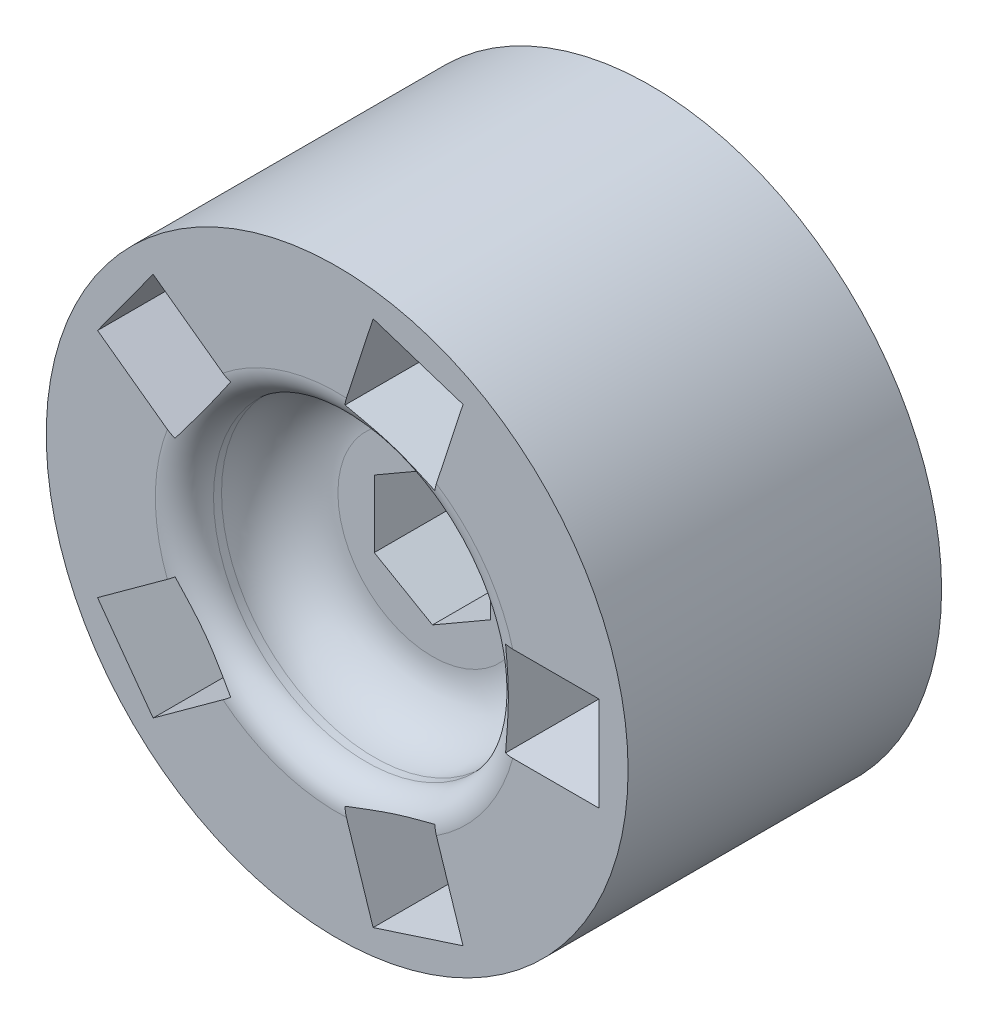
from build123d import *

# Parameters (mm, degrees)
SKETCH1_R                       = 20
SKETCH1_R_2                     = 1
BOSS_EXTRUDE1_DEPTH             = 21.55
TAP_DRILL_FOR_M5X0_8_TAP1_D     = 4.2
TAP_DRILL_FOR_M5X0_8_TAP1_DEPTH = 5
TAP_DRILL_FOR_M5X0_8_TAP1_TIP   = 1.2618073
SKETCH4_W                       = 6.5
SKETCH4_H                       = 6.5
CUT_EXTRUDE1_DEPTH              = 19.05
CIRPATTERN1_COUNT               = 5
SKETCH5_R                       = 6
SKETCH5_R_2                     = 5
CUT_EXTRUDE2_DEPTH              = 1
FILLET3_R                       = 0.5
CUT_EXTRUDE3_START              = -21.55
SKETCH6_W                       = 8
SKETCH6_H                       = 4.618
SKETCH6_R                       = 2.1
CUT_EXTRUDE3_DEPTH              = 21.55
SKETCH7_R                       = 10.5
CUT_EXTRUDE4_DEPTH              = 6.55
FILLET4_R                       = 2
FILLET5_R                       = 4


# Some blends are built 0.0001 mm under size
with BuildPart() as part:
    # Sketch1 → Boss-Extrude1 (new body)
    with BuildSketch(Plane.XY):
        with Locations((-11.822558412, 14.529752947)):
            Circle(SKETCH1_R)
        with Locations((-11.822558412, 14.529752947)):
            Circle(SKETCH1_R_2, mode=Mode.SUBTRACT)
    extrude(amount=BOSS_EXTRUDE1_DEPTH)

    # Tap Drill for M5x0.8 Tap1
    with Locations(Plane.XY.offset(21.55)):
        with Locations((-11.822558412, 14.529752947)):
            Hole(TAP_DRILL_FOR_M5X0_8_TAP1_D / 2, depth=TAP_DRILL_FOR_M5X0_8_TAP1_DEPTH)
            with Locations((0, 0, -(TAP_DRILL_FOR_M5X0_8_TAP1_DEPTH + TAP_DRILL_FOR_M5X0_8_TAP1_TIP / 2))):  # 118° drill point
                Cone(0, TAP_DRILL_FOR_M5X0_8_TAP1_D / 2, TAP_DRILL_FOR_M5X0_8_TAP1_TIP, mode=Mode.SUBTRACT)

    # Sketch4 → Cut-Extrude1 (cut)
    with BuildSketch(Plane.XY.offset(21.55)):
        with Locations((2.927441588, 14.529752947)):
            Rectangle(SKETCH4_W, SKETCH4_H)
    cut_extrude1 = extrude(amount=-CUT_EXTRUDE1_DEPTH, mode=Mode.SUBTRACT)

    # CirPattern1: Cut-Extrude1 ×5 about axis
    cirpattern1_axis = Axis((-11.822558412, 14.529752947, 0), (0, 0, 1))
    for i in range(1, CIRPATTERN1_COUNT):
        add(cut_extrude1.rotate(cirpattern1_axis, i * 360 / CIRPATTERN1_COUNT), mode=Mode.SUBTRACT)

    # Sketch5 → Cut-Extrude2 (cut)
    with BuildSketch(Plane(origin=(0, 0, 0), x_dir=(-1, 0, 0), z_dir=(0, 0, -1))):
        with Locations((11.822558412, 14.529752947)):
            Circle(SKETCH5_R)
        with Locations((11.822558412, 14.529752947)):
            Circle(SKETCH5_R_2, mode=Mode.SUBTRACT)
    extrude(amount=-CUT_EXTRUDE2_DEPTH, mode=Mode.SUBTRACT)

    # Fillet3
    fillet3_edges = [part.edges().sort_by_distance(p)[0] for p in [
        (-5.822558412, 14.529752947, 1),
        (-6.822558412, 14.529752947, 1),
    ]]
    fillet(fillet3_edges, radius=FILLET3_R - 0.0001)  # a hair under: the kernel refuses the full size

    # Sketch6 → Cut-Extrude3 (cut)
    # profile 1 of 4: a face of its own
    with BuildSketch(Plane.XY.offset(21.55).offset(CUT_EXTRUDE3_START)):
        with Locations((-11.822558412, 14.529752947)):
            Rectangle(SKETCH6_W, SKETCH6_H)
        with Locations((-11.822558412, 14.529752947)):
            Circle(SKETCH6_R, mode=Mode.SUBTRACT)
    # profile 2 of 4: a face of its own
    with BuildSketch(Plane.XY.offset(21.55).offset(CUT_EXTRUDE3_START)):
        with Locations((-11.822558412, 14.529752947)):
            Circle(SKETCH6_R)
    # profile 3 of 4: a face of its own
    with BuildSketch(Plane.XY.offset(21.55).offset(CUT_EXTRUDE3_START)):
        Polygon((-11.822558412, 19.146549298), (-7.822558412, 16.838752947), (-15.822558412, 16.838752947), align=None)
    # profile 4 of 4: a face of its own
    with BuildSketch(Plane.XY.offset(21.55).offset(CUT_EXTRUDE3_START)):
        Polygon((-11.822558412, 9.912956595), (-15.822558412, 12.220752947), (-7.822558412, 12.220752947), align=None)
    extrude(amount=CUT_EXTRUDE3_DEPTH, mode=Mode.SUBTRACT)

    # Sketch7 → Cut-Extrude4 (cut)
    with BuildSketch(Plane.XY.offset(21.55)):
        with Locations((-11.822558412, 14.529752947)):
            Circle(SKETCH7_R)
    extrude(amount=-CUT_EXTRUDE4_DEPTH, mode=Mode.SUBTRACT)

    # Fillet4
    # the kernel refuses this fillet: 2 mm, written as the material it takes off along each edge
    with BuildSketch(Plane(origin=(-11.822558412, 14.529752947, 21.55), x_dir=(1, 0, 0), z_dir=(0, -1, 0))) as fillet4_piece_1:
        with BuildLine():
            CenterArc((10.5 + FILLET4_R, -FILLET4_R), FILLET4_R, 90, 90)
            Line((10.5, -FILLET4_R), (10.5, 0))
            Line((10.5, 0), (10.5 + FILLET4_R, 0))
        make_face()
    revolve(axis=Axis((-11.822558412, 14.529752947, 21.55), (0, 0, 1)), mode=Mode.SUBTRACT)

    # Fillet5
    fillet5_edges = [part.edges().sort_by_distance(p)[0] for p in [
        (-22.322558412, 14.529752947, 15),
    ]]
    fillet(fillet5_edges, radius=FILLET5_R)


solid = part.part
